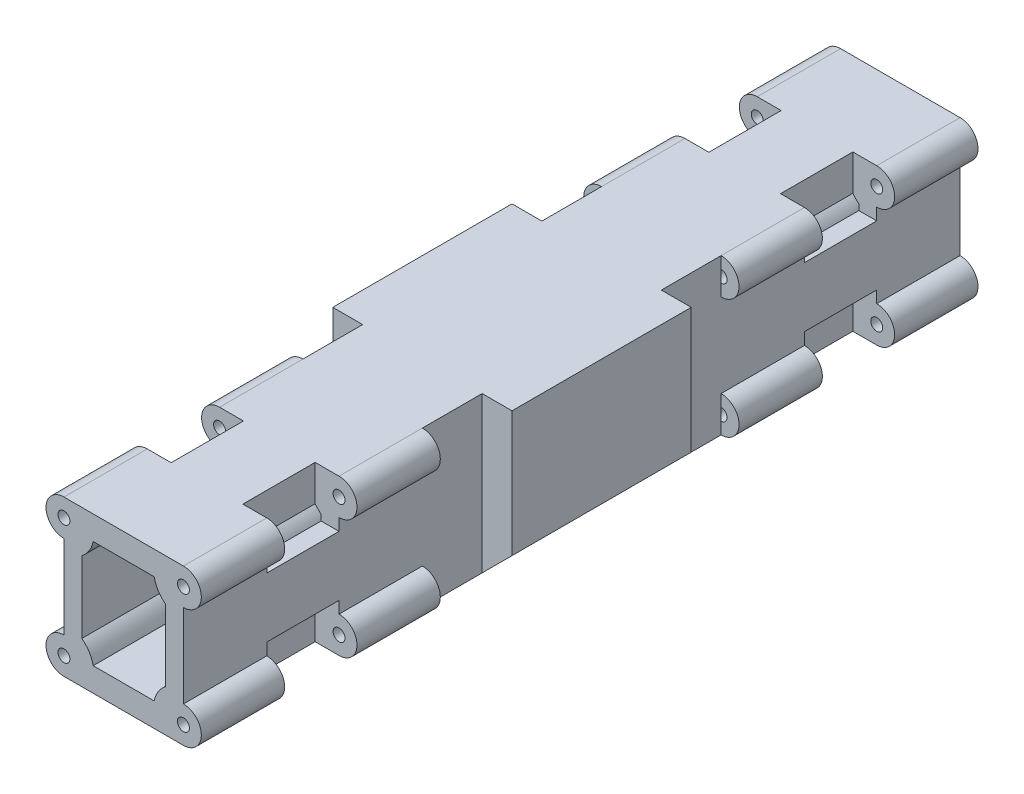
from build123d import *

# Parameters (mm, degrees)
SKETCH_1_W               = 30
SKETCH_1_H               = 26
EXTRUDE_1_DEPTH          = 65
SKETCH_7_W               = 5
SKETCH_7_H               = 26
CUT_EXTRUDE_5_DEPTH      = 50
SKETCH_4_R               = 3
EXTRUDE_3_DEPTH          = 40
SKETCH_5_W               = 12.1
SKETCH_5_H               = 8
CUT_EXTRUDE_3_DEPTH      = 4
SKETCH_6_R               = 1
CUT_EXTRUDE_4_DEPTH      = 40
MIRROR_2_COPY_1_SKETCH_W = 5
MIRROR_2_COPY_1_SKETCH_H = 26
MIRROR_2_COPY_1_DEPTH    = 50
MIRROR_2_COPY_2_SKETCH_R = 3
MIRROR_2_COPY_2_DEPTH    = 40
MIRROR_2_COPY_3_SKETCH_W = 12.1
MIRROR_2_COPY_3_SKETCH_H = 8
MIRROR_2_COPY_3_DEPTH    = 4
MIRROR_2_COPY_4_SKETCH_R = 1
MIRROR_2_COPY_4_DEPTH    = 40
MIRROR_2_COPY_5_SKETCH_W = 5
MIRROR_2_COPY_5_SKETCH_H = 26
MIRROR_2_COPY_5_DEPTH    = 50
MIRROR_2_COPY_6_SKETCH_R = 3
MIRROR_2_COPY_6_DEPTH    = 40
MIRROR_2_COPY_7_SKETCH_W = 12.1
MIRROR_2_COPY_7_SKETCH_H = 8
MIRROR_2_COPY_7_DEPTH    = 4
MIRROR_2_COPY_8_SKETCH_R = 1
MIRROR_2_COPY_8_DEPTH    = 40
CUT_EXTRUDE_7_DEPTH      = 69.018746844
CUT_EXTRUDE_7_DEPTH_BACK = 69.018746844
CUT_EXTRUDE_8_REACH      = 84.472


with BuildPart() as part:
    # Эскиз1 → Бобышка-Вытянуть1 (new, symmetric)
    with BuildSketch(Plane.XY):
        with Locations((0, -0.287208972)):
            Rectangle(SKETCH_1_W, SKETCH_1_H)
    extrude(amount=EXTRUDE_1_DEPTH, both=True)

    # Эскиз7 → Вырез-Вытянуть5 (cut)
    with BuildSketch(Plane.XY.offset(65)):
        with Locations((-12.5, -0.287208972)):
            Rectangle(SKETCH_7_W, SKETCH_7_H)
    cut_extrude_5 = extrude(amount=-CUT_EXTRUDE_5_DEPTH, mode=Mode.SUBTRACT)

    # Эскиз4 → Бобышка-Вытянуть3 (add)
    with BuildSketch(Plane.XY.offset(65)):
        with Locations((-10, 9.712791028)):
            Circle(SKETCH_4_R)
        with Locations((-10, -10.287208972)):
            Circle(SKETCH_4_R)
    extrude_3 = extrude(amount=-EXTRUDE_3_DEPTH)

    # Эскиз5 → Вырез-Вытянуть3 (cut, symmetric)
    with BuildSketch(Plane.ZY.offset(10)):
        with Locations((45, -9.287208972)):
            Rectangle(SKETCH_5_W, SKETCH_5_H)
        with Locations((45, 8.712791028)):
            Rectangle(SKETCH_5_W, SKETCH_5_H)
    cut_extrude_3 = extrude(amount=CUT_EXTRUDE_3_DEPTH, both=True, mode=Mode.SUBTRACT)

    # Эскиз6 → Вырез-Вытянуть4 (cut)
    with BuildSketch(Plane.XY.offset(65)):
        with Locations((-10, 9.712791028)):
            Circle(SKETCH_6_R)
        with Locations((-10, -10.287208972)):
            Circle(SKETCH_6_R)
    cut_extrude_4 = extrude(amount=-CUT_EXTRUDE_4_DEPTH, mode=Mode.SUBTRACT)

    # Зеркальное отражение1: Вырез-Вытянуть5, Бобышка-Вытянуть3, Вырез-Вытянуть3, Вырез-Вытянуть4 across plane
    add(cut_extrude_5.mirror(Plane.XY), mode=Mode.SUBTRACT)
    add(extrude_3.mirror(Plane.XY))
    add(cut_extrude_3.mirror(Plane.XY), mode=Mode.SUBTRACT)
    add(cut_extrude_4.mirror(Plane.XY), mode=Mode.SUBTRACT)

    # Зеркальное отражение2 copy 1 sketch → Зеркальное отражение2 copy 1 (cut)
    with BuildSketch(Plane(origin=(0, 0, -65), x_dir=(-1, 0, 0), z_dir=(0, 0, -1))):
        with Locations((-12.5, -0.287208972)):
            Rectangle(MIRROR_2_COPY_1_SKETCH_W, MIRROR_2_COPY_1_SKETCH_H)
    extrude(amount=-MIRROR_2_COPY_1_DEPTH, mode=Mode.SUBTRACT)

    # Зеркальное отражение2 copy 2 sketch → Зеркальное отражение2 copy 2 (add)
    with BuildSketch(Plane(origin=(0, 0, -65), x_dir=(-1, 0, 0), z_dir=(0, 0, -1))):
        with Locations((-10, 9.712791028)):
            Circle(MIRROR_2_COPY_2_SKETCH_R)
        with Locations((-10, -10.287208972)):
            Circle(MIRROR_2_COPY_2_SKETCH_R)
    extrude(amount=-MIRROR_2_COPY_2_DEPTH)

    # Зеркальное отражение2 copy 3 sketch → Зеркальное отражение2 copy 3 (cut, symmetric)
    with BuildSketch(Plane(origin=(10, 0, 0), x_dir=(0, 0, -1), z_dir=(1, 0, 0))):
        with Locations((45, -9.287208972)):
            Rectangle(MIRROR_2_COPY_3_SKETCH_W, MIRROR_2_COPY_3_SKETCH_H)
        with Locations((45, 8.712791028)):
            Rectangle(MIRROR_2_COPY_3_SKETCH_W, MIRROR_2_COPY_3_SKETCH_H)
    extrude(amount=MIRROR_2_COPY_3_DEPTH, both=True, mode=Mode.SUBTRACT)

    # Зеркальное отражение2 copy 4 sketch → Зеркальное отражение2 copy 4 (cut)
    with BuildSketch(Plane(origin=(0, 0, -65), x_dir=(-1, 0, 0), z_dir=(0, 0, -1))):
        with Locations((-10, 9.712791028)):
            Circle(MIRROR_2_COPY_4_SKETCH_R)
        with Locations((-10, -10.287208972)):
            Circle(MIRROR_2_COPY_4_SKETCH_R)
    extrude(amount=-MIRROR_2_COPY_4_DEPTH, mode=Mode.SUBTRACT)

    # Зеркальное отражение2 copy 5 sketch → Зеркальное отражение2 copy 5 (cut)
    with BuildSketch(Plane(origin=(0, 0, 65), x_dir=(-1, 0, 0), z_dir=(0, 0, 1))):
        with Locations((-12.5, 0.287208972)):
            Rectangle(MIRROR_2_COPY_5_SKETCH_W, MIRROR_2_COPY_5_SKETCH_H)
    extrude(amount=-MIRROR_2_COPY_5_DEPTH, mode=Mode.SUBTRACT)

    # Зеркальное отражение2 copy 6 sketch → Зеркальное отражение2 copy 6 (add)
    with BuildSketch(Plane(origin=(0, 0, 65), x_dir=(-1, 0, 0), z_dir=(0, 0, 1))):
        with Locations((-10, -9.712791028)):
            Circle(MIRROR_2_COPY_6_SKETCH_R)
        with Locations((-10, 10.287208972)):
            Circle(MIRROR_2_COPY_6_SKETCH_R)
    extrude(amount=-MIRROR_2_COPY_6_DEPTH)

    # Зеркальное отражение2 copy 7 sketch → Зеркальное отражение2 copy 7 (cut, symmetric)
    with BuildSketch(Plane(origin=(10, 0, 0), x_dir=(0, 0, 1), z_dir=(1, 0, 0))):
        with Locations((45, 9.287208972)):
            Rectangle(MIRROR_2_COPY_7_SKETCH_W, MIRROR_2_COPY_7_SKETCH_H)
        with Locations((45, -8.712791028)):
            Rectangle(MIRROR_2_COPY_7_SKETCH_W, MIRROR_2_COPY_7_SKETCH_H)
    extrude(amount=MIRROR_2_COPY_7_DEPTH, both=True, mode=Mode.SUBTRACT)

    # Зеркальное отражение2 copy 8 sketch → Зеркальное отражение2 copy 8 (cut)
    with BuildSketch(Plane(origin=(0, 0, 65), x_dir=(-1, 0, 0), z_dir=(0, 0, 1))):
        with Locations((-10, -9.712791028)):
            Circle(MIRROR_2_COPY_8_SKETCH_R)
        with Locations((-10, 10.287208972)):
            Circle(MIRROR_2_COPY_8_SKETCH_R)
    extrude(amount=-MIRROR_2_COPY_8_DEPTH, mode=Mode.SUBTRACT)

    # Эскиз9 → Вырез-Вытянуть7 (cut, two sides: drawn at the far end of the back side and taken through both)
    with BuildSketch(Plane.XY.offset(-CUT_EXTRUDE_7_DEPTH_BACK)):
        with BuildLine():
            Line((5.101020514, 8.712791028), (-5.101020514, 8.712791028))
            ThreePointArc((-5.101020514, 8.712791028), (-5.775255129, 7.038556414), (-7, 5.712791028))
            Line((-7, 5.712791028), (-7, -6.287208972))
            ThreePointArc((-7, -6.287208972), (-5.775255129, -7.612974358), (-5.101020514, -9.287208972))
            Line((-5.101020514, -9.287208972), (5.101020514, -9.287208972))
            ThreePointArc((5.101020514, -9.287208972), (5.775255129, -7.612974358), (7, -6.287208972))
            Line((7, -6.287208972), (7, 5.712791028))
            ThreePointArc((7, 5.712791028), (5.775255129, 7.038556414), (5.101020514, 8.712791028))
        make_face()
    extrude(amount=CUT_EXTRUDE_7_DEPTH + CUT_EXTRUDE_7_DEPTH_BACK, mode=Mode.SUBTRACT)

    # Эскиз10 → Вырез-Вытянуть8 (cut, up to next)
    with BuildSketch(Plane.XY.offset(15), mode=Mode.PRIVATE) as cut_extrude_8_sk1:
        Polygon((15, -8.287208972), (10, -13.287208972), (15, -13.287208972), align=None)
    cut_extrude_8_tool1 = extrude(cut_extrude_8_sk1.sketch, amount=-CUT_EXTRUDE_8_REACH, mode=Mode.PRIVATE) & part.part
    # Эскиз10 → Вырез-Вытянуть8 (cut, up to next)
    with BuildSketch(Plane.XY.offset(15), mode=Mode.PRIVATE) as cut_extrude_8_sk2:
        Polygon((-10, -13.287208972), (-15, -8.287208972), (-15, -13.287208972), align=None)
    cut_extrude_8_tool2 = extrude(cut_extrude_8_sk2.sketch, amount=-CUT_EXTRUDE_8_REACH, mode=Mode.PRIVATE) & part.part
    add(cut_extrude_8_tool1.solids().sort_by_distance((13.333333, -11.620542, 15))[0], mode=Mode.SUBTRACT)
    add(cut_extrude_8_tool2.solids().sort_by_distance((-13.333333, -11.620542, 15))[0], mode=Mode.SUBTRACT)


solid = part.part
